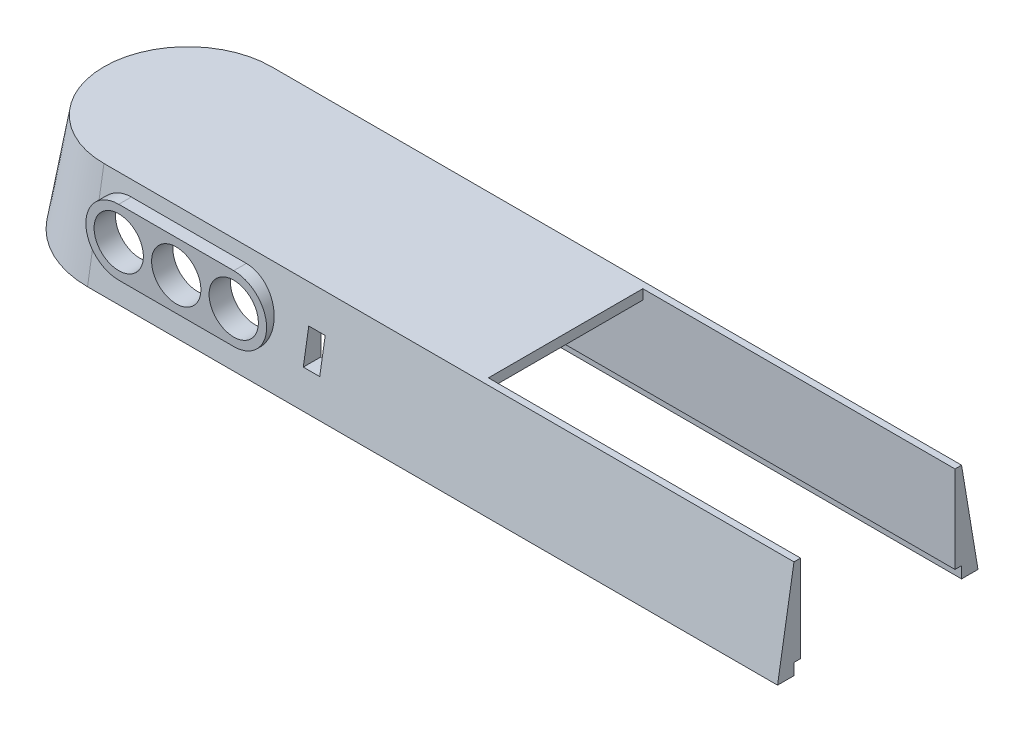
from build123d import *

# Parameters (mm, degrees)
BOSS_EXTRUDE1_DEPTH            = 210
BOSS_EXTRUDE1_2_DEPTH          = 210
REVOLVE1_ANGLE                 = 180
BOSS_EXTRUDE2_DEPTH            = 3
BOSS_EXTRUDE3_DEPTH            = 5
CUT_EXTRUDE1_REACH             = 251.458
SKETCH5_R                      = 7.5
WRAP1_START                    = -0.5
WRAP1_DEPTH                    = 0.5
CUT_EXTRUDE2_DEPTH             = 249.293173617
CUT_EXTRUDE2_DEPTH_BACK        = 249.293173617
SKETCH7_R                      = 2.5
CUT_EXTRUDE3_REACH             = 250.293
SKETCH8_W                      = 5
SKETCH8_H                      = 10
CUT_EXTRUDE3_DIRECTION_2_DEPTH = 1.5


# Read off the part's stored shape, not the designer's step: Wrap1
with BuildPart() as part:
    # Sketch1 → Boss-Extrude1 (new body)
    with BuildSketch(Plane(origin=(0, 0, 0), x_dir=(0, 0, -1), z_dir=(1, 0, 0))):
        Polygon((-0.5, 27), (-5.5, -3), (-0.5, -3), (-0.5, 0.5), (1.5, 0.5), (1.5, 27), align=None)
    extrude(amount=-BOSS_EXTRUDE1_DEPTH)



with BuildPart() as body_2:
    # Sketch1 → Boss-Extrude1 2 (new body)
    with BuildSketch(Plane(origin=(0, 0, 0), x_dir=(0, 0, -1), z_dir=(1, 0, 0))):
        Polygon((50.5, -3), (55.5, -3), (50.5, 27), (48.5, 27), (48.5, 0.5), (50.5, 0.5), align=None)
    extrude(amount=-BOSS_EXTRUDE1_2_DEPTH)


with BuildPart() as part_1:
    add(part.part)

    add(body_2.part)  # Revolve1 merges body 2
    # Sketch2 → Revolve1 (revolve)
    with BuildSketch(Plane.ZY.offset(210)):
        Polygon((-50.5, 27), (-55.5, -3), (-50.5, -3), (-50.5, 0.5), (-48.5, 0.5), (-48.5, 27), align=None)
    revolve(axis=Axis((-210, 25.927042695, -25), (0, 1, 0)), revolution_arc=REVOLVE1_ANGLE)

    # Sketch3 → Boss-Extrude2 (add)
    with BuildSketch(Plane(origin=(0, 27, 0), x_dir=(1, 0, 0), z_dir=(0, 1, 0))):
        with BuildLine():
            Line((-210, 48.5), (-95, 48.5))
            Line((-95, 48.5), (-95, 1.5))
            Line((-95, 1.5), (-210, 1.5))
            ThreePointArc((-210, 1.5), (-233.5, 25), (-210, 48.5))
        make_face()
    extrude(amount=-BOSS_EXTRUDE2_DEPTH)

    # Sketch4 → Boss-Extrude3 (add)
    with BuildSketch(Plane.XY):
        with BuildLine():
            Line((-201, 23), (-166, 23))
            ThreePointArc((-166, 23), (-156, 13), (-166, 3))
            Line((-166, 3), (-201, 3))
            ThreePointArc((-201, 3), (-211, 13), (-201, 23))
        make_face()
    extrude(amount=BOSS_EXTRUDE3_DEPTH)

    # Sketch5 → Cut-Extrude1 (cut, up to next)
    with BuildSketch(Plane.XY.offset(5), mode=Mode.PRIVATE) as cut_extrude1_sk1:
        with Locations((-201, 13)):
            Circle(SKETCH5_R)
    cut_extrude1_tool1 = extrude(cut_extrude1_sk1.sketch, amount=-CUT_EXTRUDE1_REACH, mode=Mode.PRIVATE) & part_1.part
    # Sketch5 → Cut-Extrude1 (cut, up to next)
    with BuildSketch(Plane.XY.offset(5), mode=Mode.PRIVATE) as cut_extrude1_sk2:
        with Locations((-183.5, 13)):
            Circle(SKETCH5_R)
    cut_extrude1_tool2 = extrude(cut_extrude1_sk2.sketch, amount=-CUT_EXTRUDE1_REACH, mode=Mode.PRIVATE) & part_1.part
    # Sketch5 → Cut-Extrude1 (cut, up to next)
    with BuildSketch(Plane.XY.offset(5), mode=Mode.PRIVATE) as cut_extrude1_sk3:
        with Locations((-166, 13)):
            Circle(SKETCH5_R)
    cut_extrude1_tool3 = extrude(cut_extrude1_sk3.sketch, amount=-CUT_EXTRUDE1_REACH, mode=Mode.PRIVATE) & part_1.part
    add(cut_extrude1_tool1.solids().sort_by_distance((-201, 13, 5))[0], mode=Mode.SUBTRACT)
    add(cut_extrude1_tool2.solids().sort_by_distance((-183.5, 13, 5))[0], mode=Mode.SUBTRACT)
    add(cut_extrude1_tool3.solids().sort_by_distance((-166, 13, 5))[0], mode=Mode.SUBTRACT)

    # Wrap1 outline → Wrap1 (cut)
    # profile 1 of 49: a face of its own
    with BuildSketch(Plane(origin=(0, 8.918918919, -53.513513514), x_dir=(-1, 0, 0), z_dir=(0, 0.16439898730535774, -0.9863939238321436)).offset(WRAP1_START)):
        with BuildLine():
            add(Edge.make_bspline(
                [(59.209427208, -2.895179187), (59.241102327, -2.768991937), (59.313057232, -2.482338188), (59.33268689, -2.187254256), (59.343675418, -2.022068606)],
                knots=[0, 0, 0, 0, 0.440207916, 1, 1, 1, 1], degree=3))
            add(Edge.make_bspline(
                [(59.343675418, -2.022068606), (59.333257192, -1.851888602), (59.316221691, -1.573616481), (59.07444529, -1.247018491), (58.866833153, -1.182328466), (58.762927605, -1.149952456)],
                knots=[0, 0, 0, 0, 0.440228921, 0.71984624, 1, 1, 1, 1], degree=3))
            Line((58.762927605, -1.149952456), (54.21141607, -1.149952456))
            add(Edge.make_bspline(
                [(54.21141607, -1.149952456), (54.045878909, -1.202456567), (53.714378306, -1.307599994), (53.315183603, -1.726880546), (53.020690558, -2.264277035), (52.895024971, -2.684762112), (52.832140016, -2.895179187)],
                knots=[0, 0, 0, 0, 0.219237281, 0.439039128, 0.719286718, 1, 1, 1, 1], degree=3))
            Line((52.832140016, -2.895179187), (52.426412092, -4.404725726))
            add(Edge.make_bspline(
                [(52.426412092, -4.404725726), (52.394133562, -4.530841366), (52.320806753, -4.817336985), (52.300530959, -5.112566885), (52.289180589, -5.277836307)],
                knots=[0, 0, 0, 0, 0.440200936, 1, 1, 1, 1], degree=3))
            add(Edge.make_bspline(
                [(52.289180589, -5.277836307), (52.299979291, -5.448286881), (52.31763504, -5.726971533), (52.560691714, -6.053411062), (52.768757852, -6.117747096), (52.872911695, -6.149952456)],
                knots=[0, 0, 0, 0, 0.440247002, 0.71979859, 1, 1, 1, 1], degree=3))
            Line((52.872911695, -6.149952456), (57.423428799, -6.149952456))
            add(Edge.make_bspline(
                [(57.423428799, -6.149952456), (57.588899838, -6.097350472), (57.920258032, -5.992014224), (58.318976146, -5.572451214), (58.613132465, -5.035141794), (58.739478785, -4.61498171), (58.802704853, -4.404725726)],
                knots=[0, 0, 0, 0, 0.21924125, 0.439033835, 0.719282012, 1, 1, 1, 1], degree=3))
            Line((58.802704853, -4.404725726), (59.209427208, -2.895179187))
        make_face()
        with BuildLine():
            Line((54.342680986, -1.955441717), (58.202068417, -1.955441717))
            add(Edge.make_bspline(
                [(58.202068417, -1.955441717), (58.245531575, -1.95952864), (58.332265993, -1.967684443), (58.455726836, -2.103488157), (58.461048039, -2.23419028), (58.46459825, -2.321392393)],
                knots=[0, 0, 0, 0, 0.250539934, 0.499973684, 1, 1, 1, 1], degree=3))
            add(Edge.make_bspline(
                [(58.46459825, -2.321392393), (58.458839043, -2.406798438), (58.445746767, -2.600950112), (58.397276053, -2.789545609), (58.370127287, -2.895179187)],
                knots=[0, 0, 0, 0, 0.439893428, 1, 1, 1, 1], degree=3))
            Line((58.370127287, -2.895179187), (57.964399364, -4.404725726))
            add(Edge.make_bspline(
                [(57.964399364, -4.404725726), (57.911422655, -4.574546045), (57.824805882, -4.852201806), (57.625962758, -5.233473623), (57.403274458, -5.307739697), (57.293158313, -5.344463196)],
                knots=[0, 0, 0, 0, 0.443234771, 0.724687645, 1, 1, 1, 1], degree=3))
            Line((57.293158313, -5.344463196), (53.432776452, -5.344463196))
            add(Edge.make_bspline(
                [(53.432776452, -5.344463196), (53.356999816, -5.322617398), (53.182506562, -5.272312386), (53.175311523, -5.085303869), (53.17124105, -4.979506951)],
                knots=[0, 0, 0, 0, 0.434266848, 1, 1, 1, 1], degree=3))
            add(Edge.make_bspline(
                [(53.17124105, -4.979506951), (53.176958311, -4.893951353), (53.189955283, -4.699458976), (53.238513921, -4.510540511), (53.265712013, -4.404725726)],
                knots=[0, 0, 0, 0, 0.439891778, 1, 1, 1, 1], degree=3))
            Line((53.265712013, -4.404725726), (53.671439936, -2.895179187))
            add(Edge.make_bspline(
                [(53.671439936, -2.895179187), (53.724416644, -2.725358867), (53.811033418, -2.447703107), (54.009876542, -2.066431289), (54.232564842, -1.992165216), (54.342680986, -1.955441717)],
                knots=[0, 0, 0, 0, 0.443234771, 0.724687645, 1, 1, 1, 1], degree=3))
        make_face(mode=Mode.SUBTRACT)
    # profile 2 of 49: a face of its own
    with BuildSketch(Plane(origin=(0, 8.918918919, -53.513513514), x_dir=(-1, 0, 0), z_dir=(0, 0.16439898730535774, -0.9863939238321436)).offset(WRAP1_START)):
        with BuildLine():
            Line((150.270485282, 3.81007141), (157.290373906, 3.81007141))
            add(Edge.make_bspline(
                [(157.290373906, 3.81007141), (157.555117312, 3.894228769), (158.085336392, 4.062776261), (158.722035541, 4.735087297), (159.194509814, 5.593566569), (159.396258628, 6.265961541), (159.497215593, 6.602434178)],
                knots=[0, 0, 0, 0, 0.219217683, 0.439041712, 0.719291305, 1, 1, 1, 1], degree=3))
            Line((159.497215593, 6.602434178), (160.14638027, 9.017708641))
            add(Edge.make_bspline(
                [(160.14638027, 9.017708641), (160.197060461, 9.219608241), (160.31218831, 9.678254239), (160.343595763, 10.150388531), (160.361177407, 10.414685571)],
                knots=[0, 0, 0, 0, 0.440207916, 1, 1, 1, 1], degree=3))
            add(Edge.make_bspline(
                [(160.361177407, 10.414685571), (160.344508246, 10.686973577), (160.317251444, 11.132208971), (159.930409202, 11.654765755), (159.598229784, 11.758269795), (159.431980907, 11.81007141)],
                knots=[0, 0, 0, 0, 0.440228921, 0.71984624, 1, 1, 1, 1], degree=3))
            Line((159.431980907, 11.81007141), (152.413683373, 11.81007141))
            add(Edge.make_bspline(
                [(152.413683373, 11.81007141), (152.161049009, 11.730337982), (151.655179801, 11.570681611), (151.035949968, 10.942428432), (150.565770835, 10.134018609), (150.355177219, 9.498165694), (150.249801114, 9.179999811)],
                knots=[0, 0, 0, 0, 0.219286141, 0.439093496, 0.719335543, 1, 1, 1, 1], degree=3))
            Line((150.249801114, 9.179999811), (151.592680986, 9.179999811))
            add(Edge.make_bspline(
                [(151.592680986, 9.179999811), (151.680259564, 9.424661941), (151.823465641, 9.824726716), (152.138578354, 10.363600356), (152.463129366, 10.469093718), (152.623707239, 10.521288594)],
                knots=[0, 0, 0, 0, 0.443028157, 0.724427437, 1, 1, 1, 1], degree=3))
            Line((152.623707239, 10.521288594), (158.536197295, 10.521288594))
            add(Edge.make_bspline(
                [(158.536197295, 10.521288594), (158.605555922, 10.514521206), (158.743996095, 10.501013466), (158.940484704, 10.283662502), (158.948983573, 10.074991089), (158.954653938, 9.935767512)],
                knots=[0, 0, 0, 0, 0.250455951, 0.499911358, 1, 1, 1, 1], degree=3))
            add(Edge.make_bspline(
                [(158.954653938, 9.935767512), (158.945439208, 9.799117839), (158.924491565, 9.48847516), (158.846938423, 9.186722365), (158.803500398, 9.017708641)],
                knots=[0, 0, 0, 0, 0.439893428, 1, 1, 1, 1], degree=3))
            Line((158.803500398, 9.017708641), (158.15433572, 6.602434178))
            add(Edge.make_bspline(
                [(158.15433572, 6.602434178), (158.069572987, 6.330721667), (157.930986149, 5.886472451), (157.612837151, 5.276437543), (157.256535871, 5.157611825), (157.08035004, 5.098854226)],
                knots=[0, 0, 0, 0, 0.443234771, 0.724687645, 1, 1, 1, 1], degree=3))
            Line((157.08035004, 5.098854226), (151.167859984, 5.098854226))
            add(Edge.make_bspline(
                [(151.167859984, 5.098854226), (151.097643238, 5.107067877), (150.95735203, 5.123478534), (150.771958154, 5.355296431), (150.76511215, 5.565022346), (150.760540971, 5.705059477)],
                knots=[0, 0, 0, 0, 0.249789795, 0.499073424, 1, 1, 1, 1], degree=3))
            add(Edge.make_bspline(
                [(150.760540971, 5.705059477), (150.765713253, 5.813948287), (150.7774699, 6.061453562), (150.827812026, 6.304194714), (150.856006364, 6.440143009)],
                knots=[0, 0, 0, 0, 0.439945413, 1, 1, 1, 1], degree=3))
            Line((150.856006364, 6.440143009), (149.514717582, 6.440143009))
            add(Edge.make_bspline(
                [(149.514717582, 6.440143009), (149.474535889, 6.263582794), (149.383245604, 5.862449065), (149.360427685, 5.45145945), (149.347653142, 5.221368148)],
                knots=[0, 0, 0, 0, 0.440153003, 1, 1, 1, 1], degree=3))
            add(Edge.make_bspline(
                [(149.347653142, 5.221368148), (149.364072931, 4.948103022), (149.390912295, 4.501430898), (149.770432103, 3.969874258), (150.103692447, 3.863373681), (150.270485282, 3.81007141)],
                knots=[0, 0, 0, 0, 0.440453246, 0.719953511, 1, 1, 1, 1], degree=3))
        make_face()
    # profile 3 of 49: a face of its own
    with BuildSketch(Plane(origin=(0, 8.918918919, -53.513513514), x_dir=(-1, 0, 0), z_dir=(0, 0.16439898730535774, -0.9863939238321436)).offset(WRAP1_START)):
        with BuildLine():
            add(Edge.make_bspline(
                [(86.588703262, 9.017708641), (86.639383452, 9.219608241), (86.754511301, 9.678254239), (86.785918754, 10.150388531), (86.803500398, 10.414685571)],
                knots=[0, 0, 0, 0, 0.440207916, 1, 1, 1, 1], degree=3))
            add(Edge.make_bspline(
                [(86.803500398, 10.414685571), (86.786831237, 10.686973577), (86.759574436, 11.132208971), (86.372732193, 11.654765755), (86.040552775, 11.758269795), (85.874303898, 11.81007141)],
                knots=[0, 0, 0, 0, 0.440228921, 0.71984624, 1, 1, 1, 1], degree=3))
            Line((85.874303898, 11.81007141), (78.591885442, 11.81007141))
            add(Edge.make_bspline(
                [(78.591885442, 11.81007141), (78.327025984, 11.726064833), (77.79662502, 11.55783535), (77.157913495, 10.886986466), (76.686724622, 10.027152084), (76.485659683, 9.354375962), (76.385043755, 9.017708641)],
                knots=[0, 0, 0, 0, 0.219237281, 0.439039128, 0.719286718, 1, 1, 1, 1], degree=3))
            Line((76.385043755, 9.017708641), (75.735879077, 6.602434178))
            add(Edge.make_bspline(
                [(75.735879077, 6.602434178), (75.684233429, 6.400649155), (75.566910534, 5.942256164), (75.534469264, 5.469888324), (75.516308671, 5.205457249)],
                knots=[0, 0, 0, 0, 0.440200936, 1, 1, 1, 1], degree=3))
            add(Edge.make_bspline(
                [(75.516308671, 5.205457249), (75.533586595, 4.932736331), (75.561835793, 4.486840887), (75.950726473, 3.96453764), (76.283632294, 3.861599987), (76.450278441, 3.81007141)],
                knots=[0, 0, 0, 0, 0.440247002, 0.71979859, 1, 1, 1, 1], degree=3))
            Line((76.450278441, 3.81007141), (83.731105807, 3.81007141))
            add(Edge.make_bspline(
                [(83.731105807, 3.81007141), (83.99585947, 3.894234585), (84.52603258, 4.062772583), (85.163981563, 4.734073398), (85.634631674, 5.59376847), (85.836785786, 6.266024604), (85.937947494, 6.602434178)],
                knots=[0, 0, 0, 0, 0.21924125, 0.439033835, 0.719282012, 1, 1, 1, 1], degree=3))
            Line((85.937947494, 6.602434178), (86.588703262, 9.017708641))
        make_face()
        with BuildLine():
            Line((78.801909308, 10.521288594), (84.976929196, 10.521288594))
            add(Edge.make_bspline(
                [(84.976929196, 10.521288594), (85.04647025, 10.514749516), (85.185245319, 10.501700231), (85.382782666, 10.284414289), (85.391296591, 10.075290892), (85.396976929, 9.935767512)],
                knots=[0, 0, 0, 0, 0.250539934, 0.499973684, 1, 1, 1, 1], degree=3))
            add(Edge.make_bspline(
                [(85.396976929, 9.935767512), (85.387762199, 9.799117839), (85.366814557, 9.48847516), (85.289261414, 9.186722365), (85.245823389, 9.017708641)],
                knots=[0, 0, 0, 0, 0.439893428, 1, 1, 1, 1], degree=3))
            Line((85.245823389, 9.017708641), (84.596658711, 6.602434178))
            add(Edge.make_bspline(
                [(84.596658711, 6.602434178), (84.511895978, 6.330721667), (84.37330914, 5.886472451), (84.055160142, 5.276437543), (83.698858862, 5.157611825), (83.522673031, 5.098854226)],
                knots=[0, 0, 0, 0, 0.443234771, 0.724687645, 1, 1, 1, 1], degree=3))
            Line((83.522673031, 5.098854226), (77.346062053, 5.098854226))
            add(Edge.make_bspline(
                [(77.346062053, 5.098854226), (77.224819436, 5.133807504), (76.945630229, 5.214295522), (76.934118166, 5.51350915), (76.92760541, 5.682784218)],
                knots=[0, 0, 0, 0, 0.434266848, 1, 1, 1, 1], degree=3))
            add(Edge.make_bspline(
                [(76.92760541, 5.682784218), (76.936753028, 5.819673175), (76.957548183, 6.130860978), (77.035242003, 6.433130522), (77.07875895, 6.602434178)],
                knots=[0, 0, 0, 0, 0.439891778, 1, 1, 1, 1], degree=3))
            Line((77.07875895, 6.602434178), (77.727923628, 9.017708641))
            add(Edge.make_bspline(
                [(77.727923628, 9.017708641), (77.812686361, 9.289421153), (77.951273199, 9.733670369), (78.269422197, 10.343705277), (78.625723477, 10.462530995), (78.801909308, 10.521288594)],
                knots=[0, 0, 0, 0, 0.443234771, 0.724687645, 1, 1, 1, 1], degree=3))
        make_face(mode=Mode.SUBTRACT)
    # profile 4 of 49: a face of its own
    with BuildSketch(Plane(origin=(0, 8.918918919, -53.513513514), x_dir=(-1, 0, 0), z_dir=(0, 0.16439898730535774, -0.9863939238321436)).offset(WRAP1_START)):
        with BuildLine():
            Line((35.153540175, 7.165680002), (36.631662689, 7.165680002))
            add(Edge.make_bspline(
                [(36.631662689, 7.165680002), (37.306955774, 7.194186646), (38.412146994, 7.240840895), (39.914225912, 7.604509926), (40.689563931, 7.978113853), (41.07716786, 8.164884457)],
                knots=[0, 0, 0, 0, 0.439946101, 0.72002006, 1, 1, 1, 1], degree=3))
            Line((41.07716786, 8.164884457), (38.881463803, 5.098854226))
            Line((38.881463803, 5.098854226), (34.601431981, 5.098854226))
            Line((34.601431981, 5.098854226), (34.257756563, 3.81007141))
            Line((34.257756563, 3.81007141), (39.589498807, 3.81007141))
            Line((39.589498807, 3.81007141), (45.314240255, 11.81007141))
            Line((45.314240255, 11.81007141), (43.69769292, 11.81007141))
            add(Edge.make_bspline(
                [(43.69769292, 11.81007141), (43.316257346, 11.38456137), (42.553548054, 10.533721847), (41.036906889, 9.432269717), (39.156252829, 8.604232883), (37.702386161, 8.504391425), (36.975338107, 8.454462818)],
                knots=[0, 0, 0, 0, 0.22026093, 0.440428397, 0.720170044, 1, 1, 1, 1], degree=3))
            Line((36.975338107, 8.454462818), (35.497215593, 8.454462818))
            Line((35.497215593, 8.454462818), (35.153540175, 7.165680002))
        make_face()
    # profile 5 of 49: a face of its own
    with BuildSketch(Plane(origin=(0, 8.918918919, -53.513513514), x_dir=(-1, 0, 0), z_dir=(0, 0.16439898730535774, -0.9863939238321436)).offset(WRAP1_START)):
        with BuildLine():
            Line((121.937151949, -4.404725726), (122.342879873, -2.895179187))
            add(Edge.make_bspline(
                [(122.342879873, -2.895179187), (122.398818915, -2.715816594), (122.490229611, -2.422717911), (122.738116761, -2.041859525), (122.978399689, -1.984105359), (123.097653142, -1.955441717)],
                knots=[0, 0, 0, 0, 0.442689393, 0.723404341, 1, 1, 1, 1], degree=3))
            Line((123.097653142, -1.955441717), (123.312450278, -1.149952456))
            Line((123.312450278, -1.149952456), (122.882856006, -1.149952456))
            add(Edge.make_bspline(
                [(122.882856006, -1.149952456), (122.717318846, -1.202456567), (122.385818243, -1.307599994), (121.98662354, -1.726880546), (121.692130494, -2.264277035), (121.566464908, -2.684762112), (121.503579952, -2.895179187)],
                knots=[0, 0, 0, 0, 0.219237281, 0.439039128, 0.719286718, 1, 1, 1, 1], degree=3))
            Line((121.503579952, -2.895179187), (121.097852029, -4.404725726))
            add(Edge.make_bspline(
                [(121.097852029, -4.404725726), (121.065573499, -4.530841366), (120.992246689, -4.817336985), (120.971970895, -5.112566885), (120.960620525, -5.277836307)],
                knots=[0, 0, 0, 0, 0.440200936, 1, 1, 1, 1], degree=3))
            add(Edge.make_bspline(
                [(120.960620525, -5.277836307), (120.971419227, -5.448286881), (120.989074976, -5.726971533), (121.232131651, -6.053411062), (121.440197789, -6.117747096), (121.544351631, -6.149952456)],
                knots=[0, 0, 0, 0, 0.440247002, 0.71979859, 1, 1, 1, 1], degree=3))
            Line((121.544351631, -6.149952456), (122.876889419, -6.149952456))
            Line((122.876889419, -6.149952456), (125.068615752, -2.502378868))
            Line((125.068615752, -2.502378868), (125.286396181, -6.149952456))
            Line((125.286396181, -6.149952456), (126.212211615, -6.149952456))
            Line((126.212211615, -6.149952456), (125.913882259, -1.149952456))
            Line((125.913882259, -1.149952456), (124.947295147, -1.149952456))
            Line((124.947295147, -1.149952456), (122.376690533, -5.344463196))
            Line((122.376690533, -5.344463196), (122.104216388, -5.344463196))
            add(Edge.make_bspline(
                [(122.104216388, -5.344463196), (122.028439753, -5.322617398), (121.853946498, -5.272312386), (121.846751459, -5.085303869), (121.842680986, -4.979506951)],
                knots=[0, 0, 0, 0, 0.434266848, 1, 1, 1, 1], degree=3))
            add(Edge.make_bspline(
                [(121.842680986, -4.979506951), (121.848398248, -4.893951353), (121.86139522, -4.699458976), (121.909953857, -4.510540511), (121.937151949, -4.404725726)],
                knots=[0, 0, 0, 0, 0.439891778, 1, 1, 1, 1], degree=3))
        make_face()
    # profile 6 of 49: a face of its own
    with BuildSketch(Plane(origin=(0, 8.918918919, -53.513513514), x_dir=(-1, 0, 0), z_dir=(0, 0.16439898730535774, -0.9863939238321436)).offset(WRAP1_START)):
        with BuildLine():
            Line((127.792362768, -4.404725726), (128.198090692, -2.895179187))
            add(Edge.make_bspline(
                [(128.198090692, -2.895179187), (128.254029734, -2.715816594), (128.345440431, -2.422717911), (128.593327581, -2.041859525), (128.833610508, -1.984105359), (128.952863962, -1.955441717)],
                knots=[0, 0, 0, 0, 0.442689393, 0.723404341, 1, 1, 1, 1], degree=3))
            Line((128.952863962, -1.955441717), (129.167661098, -1.149952456))
            Line((129.167661098, -1.149952456), (128.738066826, -1.149952456))
            add(Edge.make_bspline(
                [(128.738066826, -1.149952456), (128.572529665, -1.202456567), (128.241029062, -1.307599994), (127.841834359, -1.726880546), (127.547341314, -2.264277035), (127.421675727, -2.684762112), (127.358790772, -2.895179187)],
                knots=[0, 0, 0, 0, 0.219237281, 0.439039128, 0.719286718, 1, 1, 1, 1], degree=3))
            Line((127.358790772, -2.895179187), (126.953062848, -4.404725726))
            add(Edge.make_bspline(
                [(126.953062848, -4.404725726), (126.920784318, -4.530841366), (126.847457509, -4.817336985), (126.827181715, -5.112566885), (126.815831344, -5.277836307)],
                knots=[0, 0, 0, 0, 0.440200936, 1, 1, 1, 1], degree=3))
            add(Edge.make_bspline(
                [(126.815831344, -5.277836307), (126.826630047, -5.448286881), (126.844285795, -5.726971533), (127.08734247, -6.053411062), (127.295408608, -6.117747096), (127.39956245, -6.149952456)],
                knots=[0, 0, 0, 0, 0.440247002, 0.71979859, 1, 1, 1, 1], degree=3))
            Line((127.39956245, -6.149952456), (128.732100239, -6.149952456))
            Line((128.732100239, -6.149952456), (130.923826571, -2.502378868))
            Line((130.923826571, -2.502378868), (131.141607001, -6.149952456))
            Line((131.141607001, -6.149952456), (132.067422434, -6.149952456))
            Line((132.067422434, -6.149952456), (131.769093079, -1.149952456))
            Line((131.769093079, -1.149952456), (130.802505967, -1.149952456))
            Line((130.802505967, -1.149952456), (128.231901352, -5.344463196))
            Line((128.231901352, -5.344463196), (127.959427208, -5.344463196))
            add(Edge.make_bspline(
                [(127.959427208, -5.344463196), (127.883650572, -5.322617398), (127.709157318, -5.272312386), (127.701962278, -5.085303869), (127.697891806, -4.979506951)],
                knots=[0, 0, 0, 0, 0.434266848, 1, 1, 1, 1], degree=3))
            add(Edge.make_bspline(
                [(127.697891806, -4.979506951), (127.703609067, -4.893951353), (127.716606039, -4.699458976), (127.765164676, -4.510540511), (127.792362768, -4.404725726)],
                knots=[0, 0, 0, 0, 0.439891778, 1, 1, 1, 1], degree=3))
        make_face()
    # profile 7 of 49: a face of its own
    with BuildSketch(Plane(origin=(0, 8.918918919, -53.513513514), x_dir=(-1, 0, 0), z_dir=(0, 0.16439898730535774, -0.9863939238321436)).offset(WRAP1_START)):
        with BuildLine():
            Line((153.415871122, -1.955441717), (152.624303898, -4.908902337))
            add(Edge.make_bspline(
                [(152.624303898, -4.908902337), (152.584422312, -4.989569967), (152.50431471, -5.151601893), (152.121005031, -5.324783421), (151.807929277, -5.336238333), (151.583134447, -5.344463196)],
                knots=[0, 0, 0, 0, 0.218484429, 0.438855748, 1, 1, 1, 1], degree=3))
            Line((151.583134447, -5.344463196), (149.402346858, -5.344463196))
            add(Edge.make_bspline(
                [(149.402346858, -5.344463196), (149.243579697, -5.338912803), (149.005670487, -5.330595658), (148.669272227, -5.238365575), (148.611411975, -5.080214342), (148.582935561, -5.002378868)],
                knots=[0, 0, 0, 0, 0.504651999, 0.756210273, 1, 1, 1, 1], degree=3))
            add(Edge.make_bspline(
                [(148.582935561, -5.002378868), (148.583710981, -4.988484594), (148.58547268, -4.956917788), (148.592771427, -4.926135603), (148.596857597, -4.908902337)],
                knots=[0, 0, 0, 0, 0.440154567, 1, 1, 1, 1], degree=3))
            Line((148.596857597, -4.908902337), (149.603221957, -1.149952456))
            Line((149.603221957, -1.149952456), (148.763922037, -1.149952456))
            Line((148.763922037, -1.149952456), (147.667064439, -5.248003371))
            add(Edge.make_bspline(
                [(147.667064439, -5.248003371), (147.666030759, -5.25730917), (147.663681791, -5.278455952), (147.663300318, -5.299733027), (147.663086714, -5.311646967)],
                knots=[0, 0, 0, 0, 0.440057412, 1, 1, 1, 1], degree=3))
            add(Edge.make_bspline(
                [(147.663086714, -5.311646967), (147.694797663, -5.476043478), (147.758539999, -5.806497729), (148.382670064, -6.126668403), (148.865179243, -6.140626725), (149.187549722, -6.149952456)],
                knots=[0, 0, 0, 0, 0.247309427, 0.497117918, 1, 1, 1, 1], degree=3))
            Line((149.187549722, -6.149952456), (151.368337311, -6.149952456))
            add(Edge.make_bspline(
                [(151.368337311, -6.149952456), (151.708120529, -6.133031773), (152.263689069, -6.105365312), (153.006459562, -5.795669195), (153.250429746, -5.430260403), (153.37211615, -5.248003371)],
                knots=[0, 0, 0, 0, 0.441105212, 0.721236853, 1, 1, 1, 1], degree=3))
            Line((153.37211615, -5.248003371), (154.469968178, -1.149952456))
            Line((154.469968178, -1.149952456), (152.163882259, -1.149952456))
            Line((152.163882259, -1.149952456), (150.274463007, -2.710214986))
            Line((150.274463007, -2.710214986), (151.321599045, -2.710214986))
            Line((151.321599045, -2.710214986), (152.238464598, -1.955441717))
            Line((152.238464598, -1.955441717), (153.415871122, -1.955441717))
        make_face()
    # profile 8 of 49: a face of its own
    with BuildSketch(Plane(origin=(0, 8.918918919, -53.513513514), x_dir=(-1, 0, 0), z_dir=(0, 0.16439898730535774, -0.9863939238321436)).offset(WRAP1_START)):
        with BuildLine():
            Line((73.377088305, -4.404725726), (73.782816229, -2.895179187))
            add(Edge.make_bspline(
                [(73.782816229, -2.895179187), (73.838755271, -2.715816594), (73.930165968, -2.422717911), (74.178053118, -2.041859525), (74.418336045, -1.984105359), (74.537589499, -1.955441717)],
                knots=[0, 0, 0, 0, 0.442689393, 0.723404341, 1, 1, 1, 1], degree=3))
            Line((74.537589499, -1.955441717), (74.752386635, -1.149952456))
            Line((74.752386635, -1.149952456), (74.322792363, -1.149952456))
            add(Edge.make_bspline(
                [(74.322792363, -1.149952456), (74.157255202, -1.202456567), (73.825754599, -1.307599994), (73.426559896, -1.726880546), (73.132066851, -2.264277035), (73.006401264, -2.684762112), (72.943516309, -2.895179187)],
                knots=[0, 0, 0, 0, 0.219237281, 0.439039128, 0.719286718, 1, 1, 1, 1], degree=3))
            Line((72.943516309, -2.895179187), (72.537788385, -4.404725726))
            add(Edge.make_bspline(
                [(72.537788385, -4.404725726), (72.505509855, -4.530841366), (72.432183046, -4.817336985), (72.411907252, -5.112566885), (72.400556881, -5.277836307)],
                knots=[0, 0, 0, 0, 0.440200936, 1, 1, 1, 1], degree=3))
            add(Edge.make_bspline(
                [(72.400556881, -5.277836307), (72.411355584, -5.448286881), (72.429011332, -5.726971533), (72.672068007, -6.053411062), (72.880134145, -6.117747096), (72.984287987, -6.149952456)],
                knots=[0, 0, 0, 0, 0.440247002, 0.71979859, 1, 1, 1, 1], degree=3))
            Line((72.984287987, -6.149952456), (74.316825776, -6.149952456))
            Line((74.316825776, -6.149952456), (76.508552108, -2.502378868))
            Line((76.508552108, -2.502378868), (76.726332538, -6.149952456))
            Line((76.726332538, -6.149952456), (77.652147971, -6.149952456))
            Line((77.652147971, -6.149952456), (77.353818616, -1.149952456))
            Line((77.353818616, -1.149952456), (76.387231504, -1.149952456))
            Line((76.387231504, -1.149952456), (73.816626889, -5.344463196))
            Line((73.816626889, -5.344463196), (73.544152745, -5.344463196))
            add(Edge.make_bspline(
                [(73.544152745, -5.344463196), (73.468376109, -5.322617398), (73.293882855, -5.272312386), (73.286687815, -5.085303869), (73.282617343, -4.979506951)],
                knots=[0, 0, 0, 0, 0.434266848, 1, 1, 1, 1], degree=3))
            add(Edge.make_bspline(
                [(73.282617343, -4.979506951), (73.288334604, -4.893951353), (73.301331576, -4.699458976), (73.349890213, -4.510540511), (73.377088305, -4.404725726)],
                knots=[0, 0, 0, 0, 0.439891778, 1, 1, 1, 1], degree=3))
        make_face()
    # profile 9 of 49: a face of its own
    with BuildSketch(Plane(origin=(0, 8.918918919, -53.513513514), x_dir=(-1, 0, 0), z_dir=(0, 0.16439898730535774, -0.9863939238321436)).offset(WRAP1_START)):
        with BuildLine():
            Line((6.254574383, 3.81007141), (12.580747812, 3.81007141))
            add(Edge.make_bspline(
                [(12.580747812, 3.81007141), (12.845491218, 3.894228769), (13.375710298, 4.062776261), (14.012409447, 4.735087297), (14.48488372, 5.593566569), (14.686632534, 6.265961541), (14.787589499, 6.602434178)],
                knots=[0, 0, 0, 0, 0.219217683, 0.439041712, 0.719291305, 1, 1, 1, 1], degree=3))
            Line((14.787589499, 6.602434178), (15.436754177, 9.017708641))
            add(Edge.make_bspline(
                [(15.436754177, 9.017708641), (15.487434367, 9.219608241), (15.602562216, 9.678254239), (15.633969669, 10.150388531), (15.651551313, 10.414685571)],
                knots=[0, 0, 0, 0, 0.440207916, 1, 1, 1, 1], degree=3))
            add(Edge.make_bspline(
                [(15.651551313, 10.414685571), (15.634882152, 10.686973577), (15.60762535, 11.132208971), (15.220783108, 11.654765755), (14.88860369, 11.758269795), (14.722354813, 11.81007141)],
                knots=[0, 0, 0, 0, 0.440228921, 0.71984624, 1, 1, 1, 1], degree=3))
            Line((14.722354813, 11.81007141), (12.961018298, 11.81007141))
            Line((12.961018298, 11.81007141), (12.257756563, 9.179999811))
            Line((12.257756563, 9.179999811), (13.600636436, 9.179999811))
            Line((13.600636436, 9.179999811), (13.960222753, 10.521288594))
            add(Edge.make_bspline(
                [(13.960222753, 10.521288594), (14.015605107, 10.513784647), (14.126424501, 10.498769343), (14.257277979, 10.304820668), (14.262335176, 10.141726616), (14.265712013, 10.032823996)],
                knots=[0, 0, 0, 0, 0.249217286, 0.498680646, 1, 1, 1, 1], degree=3))
            add(Edge.make_bspline(
                [(14.265712013, 10.032823996), (14.254675962, 9.881698843), (14.229585835, 9.538120386), (14.142599276, 9.204553838), (14.093874304, 9.017708641)],
                knots=[0, 0, 0, 0, 0.439856312, 1, 1, 1, 1], degree=3))
            Line((14.093874304, 9.017708641), (13.444709626, 6.602434178))
            add(Edge.make_bspline(
                [(13.444709626, 6.602434178), (13.359946893, 6.330721667), (13.221360055, 5.886472451), (12.903211057, 5.276437543), (12.546909777, 5.157611825), (12.370723946, 5.098854226)],
                knots=[0, 0, 0, 0, 0.443234771, 0.724687645, 1, 1, 1, 1], degree=3))
            Line((12.370723946, 5.098854226), (7.941129674, 5.098854226))
            Line((7.941129674, 5.098854226), (9.739061257, 11.81007141))
            Line((9.739061257, 11.81007141), (8.396181384, 11.81007141))
            Line((8.396181384, 11.81007141), (6.254574383, 3.81007141))
        make_face()
    # profile 10 of 49: a face of its own
    with BuildSketch(Plane(origin=(0, 8.918918919, -53.513513514), x_dir=(-1, 0, 0), z_dir=(0, 0.16439898730535774, -0.9863939238321436)).offset(WRAP1_START)):
        Polygon((42.866945107, -1.955441717), (43.538186158, -1.955441717), (43.752983294, -1.149952456), (41.507557677, -1.149952456), (39.336714399, -4.794542751), (39.117939539, -1.149952456), (38.192124105, -1.149952456), (38.490453461, -6.149952456), (39.457040573, -6.149952456), (42.027645187, -1.955441717), (40.903937947, -6.149952456), (41.743237868, -6.149952456), align=None)
    # profile 11 of 49: a face of its own
    with BuildSketch(Plane(origin=(0, 8.918918919, -53.513513514), x_dir=(-1, 0, 0), z_dir=(0, 0.16439898730535774, -0.9863939238321436)).offset(WRAP1_START)):
        Polygon((36.524463007, -6.149952456), (37.862967383, -1.149952456), (37.023667462, -1.149952456), (35.949681782, -5.156515702), (33.268695306, -2.978711406), (32.338902148, -3.391400348), (35.738862371, -6.149952456), align=None)
    # profile 12 of 49: a face of its own
    with BuildSketch(Plane(origin=(0, 8.918918919, -53.513513514), x_dir=(-1, 0, 0), z_dir=(0, 0.16439898730535774, -0.9863939238321436)).offset(WRAP1_START)):
        Polygon((30.128281623, -2.961806076), (29.799124901, -1.149952456), (27.108194113, -1.149952456), (28.007159905, -6.149952456), (29.134844869, -6.149952456), (32.712808274, -1.149952456), (31.695505171, -1.149952456), (28.843476531, -5.136627078), (28.268695306, -1.955441717), (28.933969769, -1.955441717), (29.114956245, -2.961806076), align=None)
    # profile 13 of 49: a face of its own
    with BuildSketch(Plane(origin=(0, 8.918918919, -53.513513514), x_dir=(-1, 0, 0), z_dir=(0, 0.16439898730535774, -0.9863939238321436)).offset(WRAP1_START)):
        Polygon((23.444709626, -4.989451263), (24.474940334, -1.149952456), (23.635640414, -1.149952456), (22.605409706, -4.989451263), (21.61893397, -3.498798916), (20.571797932, -3.498798916), (22.336913286, -6.156913475), (23.088703262, -6.156913475), (26.276849642, -3.498798916), (25.229713604, -3.498798916), align=None)
    # profile 14 of 49: a face of its own
    with BuildSketch(Plane(origin=(0, 8.918918919, -53.513513514), x_dir=(-1, 0, 0), z_dir=(0, 0.16439898730535774, -0.9863939238321436)).offset(WRAP1_START)):
        Polygon((48.736077963, -1.904725726), (48.936953063, -1.149952456), (44.070206842, -1.149952456), (43.855409706, -1.951463992), (47.658114558, -1.955441717), (43.681384248, -6.149952456), (44.711614956, -6.149952456), align=None)
    # profile 15 of 49: a face of its own
    with BuildSketch(Plane(origin=(0, 8.918918919, -53.513513514), x_dir=(-1, 0, 0), z_dir=(0, 0.16439898730535774, -0.9863939238321436)).offset(WRAP1_START)):
        Polygon((67.001789976, -1.904725726), (67.202665076, -1.149952456), (62.335918854, -1.149952456), (62.121121718, -1.951463992), (65.923826571, -1.955441717), (64.695704057, -3.247207826), (62.443317422, -3.247207826), (62.228520286, -4.052697086), (63.933969769, -4.052697086), (61.947096261, -6.149952456), (62.977326969, -6.149952456), (64.994033413, -4.022864151), align=None)
    # profile 16 of 49: a face of its own
    with BuildSketch(Plane(origin=(0, 8.918918919, -53.513513514), x_dir=(-1, 0, 0), z_dir=(0, 0.16439898730535774, -0.9863939238321436)).offset(WRAP1_START)):
        Polygon((60.656324582, -6.149952456), (61.994828958, -1.149952456), (61.203261734, -1.149952456), (59.679793158, -2.213993825), (59.927406523, -2.837502178), (60.871121718, -2.216977118), (59.817024662, -6.149952456), align=None)
    # profile 17 of 49: a face of its own
    with BuildSketch(Plane(origin=(0, 8.918918919, -53.513513514), x_dir=(-1, 0, 0), z_dir=(0, 0.16439898730535774, -0.9863939238321436)).offset(WRAP1_START)):
        Polygon((139.84884646, -4.989451263), (140.879077168, -1.149952456), (140.039777247, -1.149952456), (139.009546539, -4.989451263), (138.023070804, -3.498798916), (136.975934765, -3.498798916), (138.741050119, -6.156913475), (139.492840095, -6.156913475), (142.680986476, -3.498798916), (141.633850438, -3.498798916), align=None)
    # profile 18 of 49: a face of its own
    with BuildSketch(Plane(origin=(0, 8.918918919, -53.513513514), x_dir=(-1, 0, 0), z_dir=(0, 0.16439898730535774, -0.9863939238321436)).offset(WRAP1_START)):
        Polygon((148.211018298, -1.904725726), (148.411893397, -1.149952456), (143.545147176, -1.149952456), (143.33035004, -1.951463992), (147.133054893, -1.955441717), (143.156324582, -6.149952456), (144.18655529, -6.149952456), align=None)
    # profile 19 of 49: a face of its own
    with BuildSketch(Plane(origin=(0, 8.918918919, -53.513513514), x_dir=(-1, 0, 0), z_dir=(0, 0.16439898730535774, -0.9863939238321436)).offset(WRAP1_START)):
        Polygon((168.679395386, -4.989451263), (169.709626094, -1.149952456), (168.870326173, -1.149952456), (167.840095465, -4.989451263), (166.85361973, -3.498798916), (165.806483691, -3.498798916), (167.571599045, -6.156913475), (168.323389021, -6.156913475), (171.511535402, -3.498798916), (170.464399364, -3.498798916), align=None)
    # profile 20 of 49: a face of its own
    with BuildSketch(Plane(origin=(0, 8.918918919, -53.513513514), x_dir=(-1, 0, 0), z_dir=(0, 0.16439898730535774, -0.9863939238321436)).offset(WRAP1_START)):
        Polygon((162.824184566, -4.989451263), (163.854415274, -1.149952456), (163.015115354, -1.149952456), (161.984884646, -4.989451263), (160.99840891, -3.498798916), (159.951272872, -3.498798916), (161.716388226, -6.156913475), (162.468178202, -6.156913475), (165.656324582, -3.498798916), (164.609188544, -3.498798916), align=None)
    # profile 21 of 49: a face of its own
    with BuildSketch(Plane(origin=(0, 8.918918919, -53.513513514), x_dir=(-1, 0, 0), z_dir=(0, 0.16439898730535774, -0.9863939238321436)).offset(WRAP1_START)):
        Polygon((160.133253779, -1.955441717), (160.348050915, -1.149952456), (158.102625298, -1.149952456), (155.931782021, -4.794542751), (155.71300716, -1.149952456), (154.787191726, -1.149952456), (155.085521082, -6.149952456), (156.052108194, -6.149952456), (158.622712808, -1.955441717), (157.499005569, -6.149952456), (158.338305489, -6.149952456), (159.462012729, -1.955441717), align=None)
    # profile 22 of 49: a face of its own
    with BuildSketch(Plane(origin=(0, 8.918918919, -53.513513514), x_dir=(-1, 0, 0), z_dir=(0, 0.16439898730535774, -0.9863939238321436)).offset(WRAP1_START)):
        Polygon((99.671837709, -1.955441717), (99.886634845, -1.149952456), (97.641209228, -1.149952456), (95.470365951, -4.794542751), (95.25159109, -1.149952456), (94.325775656, -1.149952456), (94.624105012, -6.149952456), (98.548130469, -6.149952456), (98.762927605, -5.344463196), (98.091686555, -5.344463196), (99.000596659, -1.955441717), align=None)
        Polygon((98.161296738, -1.955441717), (97.252386635, -5.344463196), (96.083929992, -5.344463196), align=None, mode=Mode.SUBTRACT)
    # profile 23 of 49: a face of its own
    with BuildSketch(Plane(origin=(0, 8.918918919, -53.513513514), x_dir=(-1, 0, 0), z_dir=(0, 0.16439898730535774, -0.9863939238321436)).offset(WRAP1_START)):
        Polygon((108.882259348, -1.887820396), (109.084128878, -1.149952456), (104.180588703, -1.149952456), (105.079554495, -6.149952456), (109.084128878, -6.149952456), (110.422633254, -1.149952456), (109.583333333, -1.149952456), (108.459626094, -5.344463196), (105.952665076, -5.344463196), (105.341089897, -1.955441717), (108.026054097, -1.955441717), (107.845067621, -2.626682767), (108.684367542, -2.626682767), align=None)
    # profile 24 of 49: a face of its own
    with BuildSketch(Plane(origin=(0, 8.918918919, -53.513513514), x_dir=(-1, 0, 0), z_dir=(0, 0.16439898730535774, -0.9863939238321436)).offset(WRAP1_START)):
        Polygon((114.424224344, -6.149952456), (115.762728719, -1.149952456), (114.923428799, -1.149952456), (113.849443119, -5.156515702), (111.168456643, -2.978711406), (110.238663484, -3.391400348), (113.638623707, -6.149952456), align=None)
    # profile 25 of 49: a face of its own
    with BuildSketch(Plane(origin=(0, 8.918918919, -53.513513514), x_dir=(-1, 0, 0), z_dir=(0, 0.16439898730535774, -0.9863939238321436)).offset(WRAP1_START)):
        Polygon((121.437947494, -1.955441717), (121.65274463, -1.149952456), (119.407319014, -1.149952456), (117.236475736, -4.794542751), (117.017700875, -1.149952456), (116.091885442, -1.149952456), (116.390214797, -6.149952456), (117.356801909, -6.149952456), (119.927406523, -1.955441717), (118.803699284, -6.149952456), (119.642999204, -6.149952456), (120.766706444, -1.955441717), align=None)
    # profile 26 of 49: a face of its own
    with BuildSketch(Plane(origin=(0, 8.918918919, -53.513513514), x_dir=(-1, 0, 0), z_dir=(0, 0.16439898730535774, -0.9863939238321436)).offset(WRAP1_START)):
        Polygon((84.588305489, -1.955441717), (84.803102625, -1.149952456), (82.557677009, -1.149952456), (80.386833731, -4.794542751), (80.16805887, -1.149952456), (79.242243437, -1.149952456), (79.540572792, -6.149952456), (80.507159905, -6.149952456), (83.077764519, -1.955441717), (81.954057279, -6.149952456), (82.7933572, -6.149952456), (83.917064439, -1.955441717), align=None)
    # profile 27 of 49: a face of its own
    with BuildSketch(Plane(origin=(0, 8.918918919, -53.513513514), x_dir=(-1, 0, 0), z_dir=(0, 0.16439898730535774, -0.9863939238321436)).offset(WRAP1_START)):
        Polygon((89.786197295, -1.904725726), (89.987072395, -1.149952456), (85.120326173, -1.149952456), (84.905529037, -1.951463992), (88.70823389, -1.955441717), (84.73150358, -6.149952456), (85.761734288, -6.149952456), align=None)
    # profile 28 of 49: a face of its own
    with BuildSketch(Plane(origin=(0, 8.918918919, -53.513513514), x_dir=(-1, 0, 0), z_dir=(0, 0.16439898730535774, -0.9863939238321436)).offset(WRAP1_START)):
        Polygon((72.87788385, -1.955441717), (73.092680986, -1.149952456), (70.84725537, -1.149952456), (68.676412092, -4.794542751), (68.457637232, -1.149952456), (67.531821798, -1.149952456), (67.830151154, -6.149952456), (68.796738266, -6.149952456), (71.36734288, -1.955441717), (70.24363564, -6.149952456), (71.082935561, -6.149952456), (72.2066428, -1.955441717), align=None)
    # profile 29 of 49: a face of its own
    with BuildSketch(Plane(origin=(0, 8.918918919, -53.513513514), x_dir=(-1, 0, 0), z_dir=(0, 0.16439898730535774, -0.9863939238321436)).offset(WRAP1_START)):
        Polygon((172.92601432, 5.666873319), (171.347653142, 8.051917074), (169.672235481, 8.051917074), (172.496420048, 3.798933781), (173.69928401, 3.798933781), (178.800318218, 8.051917074), (177.124900557, 8.051917074), (174.268894193, 5.666873319), (175.917263325, 11.81007141), (174.574383453, 11.81007141), align=None)
    # profile 30 of 49: a face of its own
    with BuildSketch(Plane(origin=(0, 8.918918919, -53.513513514), x_dir=(-1, 0, 0), z_dir=(0, 0.16439898730535774, -0.9863939238321436)).offset(WRAP1_START)):
        Polygon((111.420843278, 5.666873319), (109.8424821, 8.051917074), (108.167064439, 8.051917074), (110.991249006, 3.798933781), (112.194112967, 3.798933781), (117.295147176, 8.051917074), (115.619729515, 8.051917074), (112.76372315, 5.666873319), (114.412092283, 11.81007141), (113.069212411, 11.81007141), align=None)
    # profile 31 of 49: a face of its own
    with BuildSketch(Plane(origin=(0, 8.918918919, -53.513513514), x_dir=(-1, 0, 0), z_dir=(0, 0.16439898730535774, -0.9863939238321436)).offset(WRAP1_START)):
        Polygon((63.459029435, 5.666873319), (61.880668258, 8.051917074), (60.205250597, 8.051917074), (63.029435163, 3.798933781), (64.232299125, 3.798933781), (69.333333333, 8.051917074), (67.657915672, 8.051917074), (64.801909308, 5.666873319), (66.450278441, 11.81007141), (65.107398568, 11.81007141), align=None)
    # profile 32 of 49: a face of its own
    with BuildSketch(Plane(origin=(0, 8.918918919, -53.513513514), x_dir=(-1, 0, 0), z_dir=(0, 0.16439898730535774, -0.9863939238321436)).offset(WRAP1_START)):
        Polygon((169.963404932, 10.521288594), (170.30708035, 11.81007141), (166.714399364, 11.81007141), (163.241050119, 5.978726939), (162.891010342, 11.81007141), (161.409705648, 11.81007141), (161.887032617, 3.81007141), (163.433571997, 3.81007141), (167.546539379, 10.521288594), (165.748607796, 3.81007141), (167.091487669, 3.81007141), (168.889419252, 10.521288594), align=None)
    # profile 33 of 49: a face of its own
    with BuildSketch(Plane(origin=(0, 8.918918919, -53.513513514), x_dir=(-1, 0, 0), z_dir=(0, 0.16439898730535774, -0.9863939238321436)).offset(WRAP1_START)):
        Polygon((186.902147971, 3.81007141), (189.043754972, 11.81007141), (187.700875099, 11.81007141), (185.864757359, 4.963611585), (182.272076372, 11.81007141), (180.61256961, 11.81007141), (184.813046937, 3.81007141), align=None)
    # profile 34 of 49: a face of its own
    with BuildSketch(Plane(origin=(0, 8.918918919, -53.513513514), x_dir=(-1, 0, 0), z_dir=(0, 0.16439898730535774, -0.9863939238321436)).offset(WRAP1_START)):
        Polygon((144.666666667, 6.494240066), (146.089101034, 11.81007141), (144.746221161, 11.81007141), (143.323786794, 6.494240066), align=None)
    # profile 35 of 49: a face of its own
    with BuildSketch(Plane(origin=(0, 8.918918919, -53.513513514), x_dir=(-1, 0, 0), z_dir=(0, 0.16439898730535774, -0.9863939238321436)).offset(WRAP1_START)):
        Polygon((95.288782816, 10.602434178), (95.610182975, 11.81007141), (87.823389021, 11.81007141), (87.479713604, 10.527652953), (93.564041368, 10.521288594), (87.201272872, 3.81007141), (88.849642005, 3.81007141), align=None)
    # profile 36 of 49: a face of its own
    with BuildSketch(Plane(origin=(0, 8.918918919, -53.513513514), x_dir=(-1, 0, 0), z_dir=(0, 0.16439898730535774, -0.9863939238321436)).offset(WRAP1_START)):
        Polygon((97.253778839, 3.81007141), (99.395385839, 11.81007141), (98.128878282, 11.81007141), (95.69132856, 10.107605221), (96.087509944, 9.109991855), (97.597454256, 10.102831951), (95.910898966, 3.81007141), align=None)
    # profile 37 of 49: a face of its own
    with BuildSketch(Plane(origin=(0, 8.918918919, -53.513513514), x_dir=(-1, 0, 0), z_dir=(0, 0.16439898730535774, -0.9863939238321436)).offset(WRAP1_START)):
        Polygon((106.660302307, 3.81007141), (108.801909308, 11.81007141), (107.459029435, 11.81007141), (105.622911695, 4.963611585), (102.030230708, 11.81007141), (100.370723946, 11.81007141), (104.571201273, 3.81007141), align=None)
    # profile 38 of 49: a face of its own
    with BuildSketch(Plane(origin=(0, 8.918918919, -53.513513514), x_dir=(-1, 0, 0), z_dir=(0, 0.16439898730535774, -0.9863939238321436)).offset(WRAP1_START)):
        Polygon((142.369132856, 4.990660113), (141.193317422, 11.81007141), (136.434367542, 11.81007141), (131.607000796, 4.990660113), (131.880668258, 3.81007141), (141.460620525, 3.81007141), align=None)
        Polygon((133.255369928, 5.098854226), (137.143993636, 10.521288594), (139.796340493, 10.521288594), (140.77326969, 5.098854226), align=None, mode=Mode.SUBTRACT)
    # profile 39 of 49: a face of its own
    with BuildSketch(Plane(origin=(0, 8.918918919, -53.513513514), x_dir=(-1, 0, 0), z_dir=(0, 0.16439898730535774, -0.9863939238321436)).offset(WRAP1_START)):
        Polygon((132.536197295, 10.527652953), (132.879872713, 11.81007141), (125.093078759, 11.81007141), (124.7716786, 10.602434178), (127.568814638, 3.81007141), (129.217183771, 3.81007141), (126.451869531, 10.521288594), align=None)
    # profile 40 of 49: a face of its own
    with BuildSketch(Plane(origin=(0, 8.918918919, -53.513513514), x_dir=(-1, 0, 0), z_dir=(0, 0.16439898730535774, -0.9863939238321436)).offset(WRAP1_START)):
        Polygon((34.022275259, 4.990660113), (32.846459825, 11.81007141), (28.087509944, 11.81007141), (23.260143198, 4.990660113), (23.53381066, 3.81007141), (33.113762928, 3.81007141), align=None)
        Polygon((24.908512331, 5.098854226), (28.797136038, 10.521288594), (31.449482896, 10.521288594), (32.426412092, 5.098854226), align=None, mode=Mode.SUBTRACT)
    # profile 41 of 49: a face of its own
    with BuildSketch(Plane(origin=(0, 8.918918919, -53.513513514), x_dir=(-1, 0, 0), z_dir=(0, 0.16439898730535774, -0.9863939238321436)).offset(WRAP1_START)):
        Polygon((24.211614956, 10.602434178), (24.533015115, 11.81007141), (16.746221161, 11.81007141), (16.402545744, 10.527652953), (22.486873508, 10.521288594), (16.124105012, 3.81007141), (17.772474145, 3.81007141), align=None)
    # profile 42 of 49: a face of its own
    with BuildSketch(Plane(origin=(0, 8.918918919, -53.513513514), x_dir=(-1, 0, 0), z_dir=(0, 0.16439898730535774, -0.9863939238321436)).offset(WRAP1_START)):
        Polygon((54.284805091, 10.521288594), (54.628480509, 11.81007141), (51.035799523, 11.81007141), (47.562450278, 5.978726939), (47.212410501, 11.81007141), (45.731105807, 11.81007141), (46.208432776, 3.81007141), (47.754972156, 3.81007141), (51.867939539, 10.521288594), (50.070007955, 3.81007141), (51.412887828, 3.81007141), (53.210819411, 10.521288594), align=None)
    # profile 43 of 49: a face of its own
    with BuildSketch(Plane(origin=(0, 8.918918919, -53.513513514), x_dir=(-1, 0, 0), z_dir=(0, 0.16439898730535774, -0.9863939238321436)).offset(WRAP1_START)):
        Polygon((55.056483691, 6.494240066), (56.478918059, 11.81007141), (55.136038186, 11.81007141), (53.713603819, 6.494240066), align=None)
    # profile 44 of 49: a face of its own
    with BuildSketch(Plane(origin=(0, 8.918918919, -53.513513514), x_dir=(-1, 0, 0), z_dir=(0, 0.16439898730535774, -0.9863939238321436)).offset(WRAP1_START)):
        Polygon((148.322991249, 9.125902754), (146.900556881, 3.81007141), (148.243436754, 3.81007141), (149.665871122, 9.125902754), align=None)
    # profile 45 of 49: a face of its own
    with BuildSketch(Plane(origin=(0, 8.918918919, -53.513513514), x_dir=(-1, 0, 0), z_dir=(0, 0.16439898730535774, -0.9863939238321436)).offset(WRAP1_START)):
        Polygon((58.712808274, 9.125902754), (57.290373906, 3.81007141), (58.633253779, 3.81007141), (60.055688146, 9.125902754), align=None)
    # profile 46 of 49: a face of its own
    with BuildSketch(Plane(origin=(0, 8.918918919, -53.513513514), x_dir=(-1, 0, 0), z_dir=(0, 0.16439898730535774, -0.9863939238321436)).offset(WRAP1_START)):
        Polygon((179.599045346, 7.294558283), (178.663484487, 6.295353828), (182.7716786, 3.760747623), (183.705648369, 4.759952078), align=None)
    # profile 47 of 49: a face of its own
    with BuildSketch(Plane(origin=(0, 8.918918919, -53.513513514), x_dir=(-1, 0, 0), z_dir=(0, 0.16439898730535774, -0.9863939238321436)).offset(WRAP1_START)):
        Polygon((146.175019889, 9.125902754), (145.471758154, 6.494240066), (146.814638027, 6.494240066), (147.517899761, 9.125902754), align=None)
    # profile 48 of 49: a face of its own
    with BuildSketch(Plane(origin=(0, 8.918918919, -53.513513514), x_dir=(-1, 0, 0), z_dir=(0, 0.16439898730535774, -0.9863939238321436)).offset(WRAP1_START)):
        Polygon((56.564836913, 9.125902754), (55.861575179, 6.494240066), (57.204455052, 6.494240066), (57.907716786, 9.125902754), align=None)
    # profile 49 of 49: a face of its own
    with BuildSketch(Plane(origin=(0, 8.918918919, -53.513513514), x_dir=(-1, 0, 0), z_dir=(0, 0.16439898730535774, -0.9863939238321436)).offset(WRAP1_START)):
        Polygon((99.357199682, 7.294558283), (98.421638823, 6.295353828), (102.529832936, 3.760747623), (103.463802705, 4.759952078), align=None)
    extrude(amount=WRAP1_DEPTH, mode=Mode.SUBTRACT)

    # Sketch7 → Cut-Extrude2 (cut, two sides: drawn at the far end of the back side and taken through both)
    with BuildSketch(Plane(origin=(0, 0, 0), x_dir=(0, 0, -1), z_dir=(1, 0, 0)).offset(-CUT_EXTRUDE2_DEPTH_BACK)):
        with Locations((25, 9)):
            Circle(SKETCH7_R)
    extrude(amount=CUT_EXTRUDE2_DEPTH + CUT_EXTRUDE2_DEPTH_BACK, mode=Mode.SUBTRACT)

    # Cut-Extrude3: up to this plane
    cut_extrude3_end = Plane(origin=(-210, 27, 0.5), z_dir=(0, 0.1643989873053573, 0.9863939238321437))
    # Sketch8 → Cut-Extrude3 (cut, up to the surface)
    with BuildSketch(Plane.XY, mode=Mode.PRIVATE) as cut_extrude3_sk1:
        with Locations((-143.5, 12)):
            Rectangle(SKETCH8_W, SKETCH8_H)
    cut_extrude3_tool1 = split(extrude(cut_extrude3_sk1.sketch, amount=CUT_EXTRUDE3_REACH, mode=Mode.PRIVATE), bisect_by=cut_extrude3_end, keep=Keep.BOTH, mode=Mode.PRIVATE)
    add(cut_extrude3_tool1.solids().sort_by_distance((-143.5, 12, 0))[0], mode=Mode.SUBTRACT)

    # Sketch8 → Cut-Extrude3 direction 2 (cut)
    with BuildSketch(Plane.XY):
        with Locations((-143.5, 12)):
            Rectangle(SKETCH8_W, SKETCH8_H)
    extrude(amount=-CUT_EXTRUDE3_DIRECTION_2_DEPTH, mode=Mode.SUBTRACT)


solid = part_1.part
